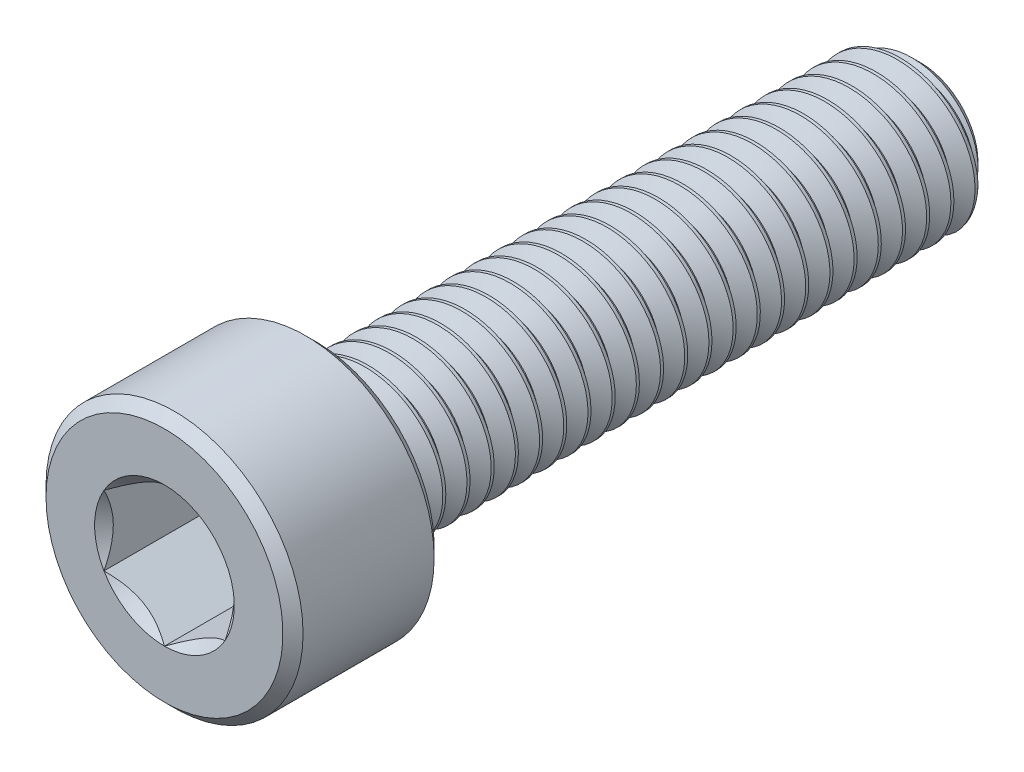
from build123d import *

# Parameters (mm, degrees)
CUT_EXTRUDE1_DEPTH = 4
CUT_SWEEP1_PITCH   = 0.8
CUT_SWEEP1_TO      = 20


with BuildPart() as part:
    # Sketch2 → Revolve1 (revolve)
    with BuildSketch(Plane(origin=(0, 0, 0), x_dir=(0, 0, -1), z_dir=(1, 0, 0)), mode=Mode.PRIVATE) as revolve1_sk:
        Polygon((-12.5, 0), (-12.5, 3.916666667), (-12.166666667, 4.25), (-7.833333333, 4.25), (-7.5, 3.916666667), (-7.5, 2.5), (11.9, 2.5), (12.5, 1.9), (12.5, 0), align=None)
    revolve(revolve1_sk.sketch.rotate(Axis((0, 0, -12.5), (0, 0, 1)), 90), axis=Axis((0, 0, -12.5), (0, 0, 1)))

    # Sketch3 → Cut-Extrude1 (cut)
    with BuildSketch(Plane.XY.offset(12.5)):
        Polygon((0, 2.309401077), (-2, 1.154700538), (-2, -1.154700538), (0, -2.309401077), (2, -1.154700538), (2, 1.154700538), align=None)
    extrude(amount=-CUT_EXTRUDE1_DEPTH, mode=Mode.SUBTRACT)

    # Cut-Extrude2 cone 1 section (through the dimple's axis) → Cut-Extrude2 (revolve, cut)
    with BuildSketch(Plane(origin=(0, 0, 12.5), x_dir=(0, -1, 0), z_dir=(1, 0, 0))):
        Polygon((0, 0), (2.309401077, 0), (0, 2.309401077), align=None)
    revolve(axis=Axis((0, 0, 12.5), (0, 0, -1)), mode=Mode.SUBTRACT)


with BuildPart() as body_2:
    # Split1: read off the stored shape, not the designer's step
    # Split1: the piece on the far side of the plane
    add(part.part)
    split(bisect_by=Plane.XY.offset(7.5), keep=Keep.BOTTOM)

    # Cut-Sweep1: arcs per turn and ends read off the stored shape
    # Cut-Sweep1: the profile of Sketch6 screwed along a right-hand helix through 26 turns, 8 arcs to a turn; built about Z, then put on its axis
    cut_sweep1_z = Axis((0, 0, 0), (0, 0, 1))
    cut_sweep1_corners = [(2.54330127, 0, 0.025), (2.54330127, 0, -0.725), (1.980384758, 0, -0.4), (1.980384758, 0, -0.3)]
    with BuildLine(mode=Mode.PRIVATE) as cut_sweep1_profile:
        Line(cut_sweep1_corners[0], cut_sweep1_corners[1])
        Line(cut_sweep1_corners[1], cut_sweep1_corners[2])
        Line(cut_sweep1_corners[2], cut_sweep1_corners[3])
        Line(cut_sweep1_corners[3], cut_sweep1_corners[0])
    cut_sweep1_cap = Face(cut_sweep1_profile.wire())
    cut_sweep1_turn_angles = [0, 22.5, 45, 67.5, 90, 112.5, 135, 157.5, 180, 202.5, 225, 247.5, 270, 292.5, 315, 337.5, 360]
    cut_sweep1_turn_weights = [1, 0.9238795325112867, 1, 0.9238795325112867, 1, 0.9238795325112867, 1, 0.9238795325112867, 1, 0.9238795325112867, 1, 0.9238795325112867, 1, 0.9238795325112867, 1, 0.9238795325112867, 1]
    cut_sweep1_turn_rails = [Edge.make_bspline([Vector(p[0], p[1], 0).rotate(cut_sweep1_z, cut_sweep1_turn_angles[k]) / cut_sweep1_turn_weights[k] + Vector(0, 0, p[2] + CUT_SWEEP1_PITCH * cut_sweep1_turn_angles[k] / 360) for k in range(17)], [0, 0, 0, 1, 1, 2, 2, 3, 3, 4, 4, 5, 5, 6, 6, 7, 7, 8, 8, 8], 2, cut_sweep1_turn_weights) for p in cut_sweep1_corners]
    cut_sweep1_turn_sides = [Face.make_surface_from_curves(cut_sweep1_turn_rails[p[0]], cut_sweep1_turn_rails[p[1]]) for p in [(0, 1), (1, 2), (2, 3), (3, 0)]]
    cut_sweep1 = Plane(origin=(0, 0, -12.5), x_dir=(0, 1, 0), z_dir=(0, 0, 1)) * split(Solid(Shell([*[p.moved(Location((0, 0, CUT_SWEEP1_PITCH * i))) for i in range(26) for p in cut_sweep1_turn_sides], cut_sweep1_cap, cut_sweep1_cap.rotate(cut_sweep1_z, 9360).moved(Location((0, 0, CUT_SWEEP1_PITCH * 9360 / 360)))])), bisect_by=Plane.XY.offset(CUT_SWEEP1_TO), keep=Keep.BOTTOM, mode=Mode.PRIVATE)
    add(cut_sweep1, mode=Mode.SUBTRACT)


with BuildPart() as part_1:
    add(part.part)

    # Split1
    split(bisect_by=Plane.XY.offset(7.5), keep=Keep.TOP)

    add(body_2.part)  # Boss-Extrude2 merges body 2
    # Boss-Extrude2: read off the stored shape, not the designer's step
    # Boss-Extrude2 outline → Boss-Extrude2 (revolve)
    with BuildSketch(Plane.XZ):
        Polygon((1.980383799, 7.5), (1.980383799, 6.072366222), (2.5, 7.5), align=None)
    revolve(axis=Axis((0, 0, 0), (0, 0, 1)))


solid = part_1.part
